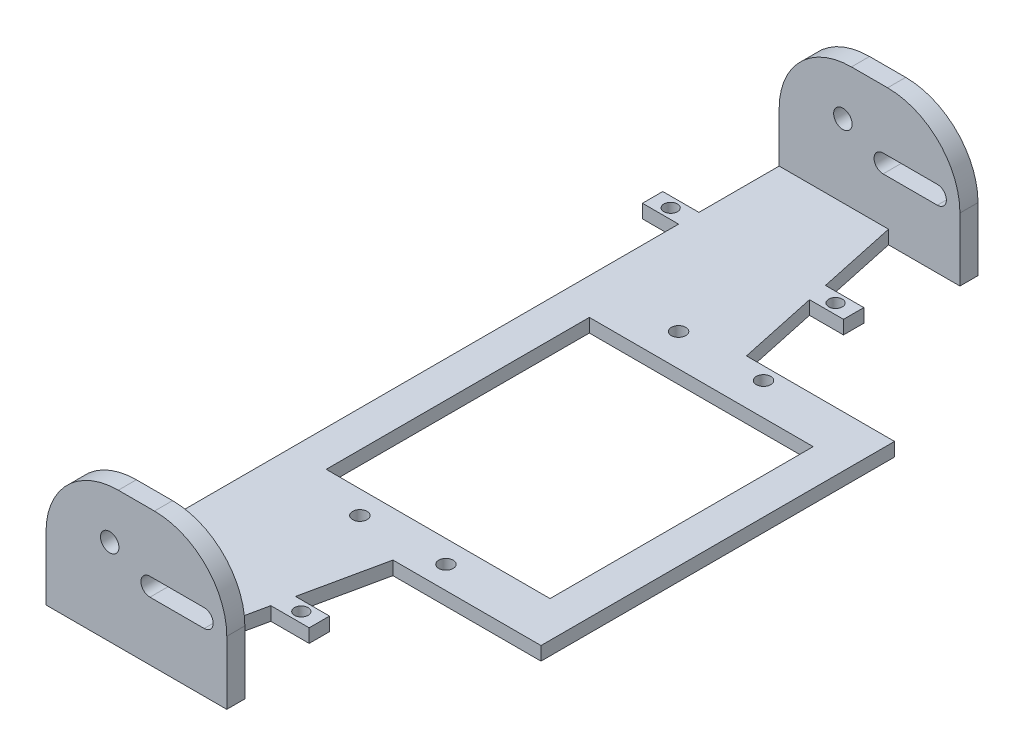
from build123d import *

# Parameters (mm, degrees)
SKETCH1_R               = 1.6
SKETCH1_R_2             = 1.599939077
SKETCH1_W               = 49.532
SKETCH1_H               = 58.229021166
SKETCH1_R_3             = 1.599995589
SKETCH1_R_4             = 1.5
BOSS_EXTRUDE1_DEPTH     = 3
SKETCH2_W               = 40
SKETCH2_H               = 4
BOSS_EXTRUDE2_DEPTH     = 30
CUT_EXTRUDE1_DEPTH      = 111.01120349
CUT_EXTRUDE1_DEPTH_BACK = 111.01120349
SKETCH3_R               = 2.040732852
CUT_EXTRUDE2_DEPTH      = 182.180933052
CUT_EXTRUDE2_DEPTH_BACK = 182.180933052
FILLET1_R               = 16


with BuildPart() as part:
    # Sketch1 → Boss-Extrude1 (new body)
    with BuildSketch(Plane(origin=(0, 0, 0), x_dir=(1, 0, 0), z_dir=(0, 1, 0))):
        Polygon((65.532, 39.114510583), (32.766, 39.114510583), (28.9648375, 56.864510583), (36.483, 56.864510583), (36.483, 61.364510583), (28.0011625, 61.364510583), (24.2, 79.114510583), (0, 79.114510583), (0, 61.364510583), (-8, 61.364510583), (-8, 56.864510583), (0, 56.864510583), (0, -56.864510583), (-8, -56.864510583), (-8, -61.364510583), (0, -61.364510583), (0, -79.114510583), (24.2, -79.114510583), (28.0011625, -61.364510583), (36.483, -61.364510583), (36.483, -56.864510583), (28.9648375, -56.864510583), (32.766, -39.114510583), (65.532, -39.114510583), align=None)
        with Locations((20.574, -34.241549338)):
            Circle(SKETCH1_R, mode=Mode.SUBTRACT)
        with Locations((39.450944, -34.068499927)):
            Circle(SKETCH1_R_2, mode=Mode.SUBTRACT)
        with Locations((32.766, 0)):
            Rectangle(SKETCH1_W, SKETCH1_H, mode=Mode.SUBTRACT)
        with Locations((20.574, 36.286821056)):
            Circle(SKETCH1_R_3, mode=Mode.SUBTRACT)
        with Locations((39.37, 36.286821056)):
            Circle(SKETCH1_R_2, mode=Mode.SUBTRACT)
        with Locations((-4, 59.114510583)):
            Circle(SKETCH1_R_4, mode=Mode.SUBTRACT)
        with Locations((32.483, 59.114510583)):
            Circle(SKETCH1_R_4, mode=Mode.SUBTRACT)
        with Locations((32.483, -59.114510583)):
            Circle(SKETCH1_R_4, mode=Mode.SUBTRACT)
        with Locations((-4, -59.114510583)):
            Circle(SKETCH1_R_4, mode=Mode.SUBTRACT)
    extrude(amount=BOSS_EXTRUDE1_DEPTH)

    # Sketch2 → Boss-Extrude2 (add)
    with BuildSketch(Plane(origin=(0, 0, 0), x_dir=(1, 0, 0), z_dir=(0, 1, 0))):
        with Locations((20, -81.114510583)):
            Rectangle(SKETCH2_W, SKETCH2_H)
        with Locations((20, 81.114510583)):
            Rectangle(SKETCH2_W, SKETCH2_H)
    extrude(amount=BOSS_EXTRUDE2_DEPTH)

    # Sketch3 → Cut-Extrude1 (cut, two sides: drawn at the far end of the back side and taken through both)
    with BuildSketch(Plane.XY.offset(-CUT_EXTRUDE1_DEPTH_BACK)):
        with Locations((14.1, 19.1)):
            Circle(SKETCH3_R)
    extrude(amount=CUT_EXTRUDE1_DEPTH + CUT_EXTRUDE1_DEPTH_BACK, mode=Mode.SUBTRACT)

    # Sketch4 → Cut-Extrude2 (cut, two sides: drawn at the far end of the back side and taken through both)
    with BuildSketch(Plane.XY.offset(83.114510583).offset(-CUT_EXTRUDE2_DEPTH_BACK)):
        with BuildLine():
            Line((35, 17), (23, 17))
            ThreePointArc((23, 17), (21, 15), (23, 13))
            Line((23, 13), (35, 13))
            ThreePointArc((35, 13), (37, 15), (35, 17))
        make_face()
    extrude(amount=CUT_EXTRUDE2_DEPTH + CUT_EXTRUDE2_DEPTH_BACK, mode=Mode.SUBTRACT)

    # Fillet1
    fillet1_edges = [part.edges().sort_by_distance(p)[0] for p in [
        (0, 30, -81.114510583),
        (40, 30, -81.114510583),
        (40, 30, 81.114510583),
        (0, 30, 81.114510583),
    ]]
    fillet(fillet1_edges, radius=FILLET1_R)


solid = part.part
